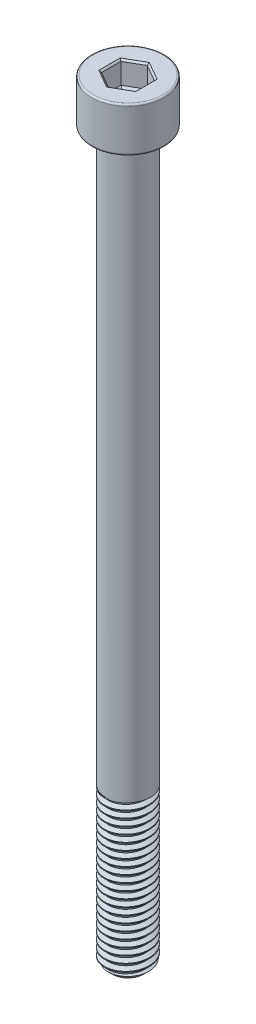
from build123d import *

# Parameters (mm, degrees)
SKETCH1_R           = 4
BOSS_EXTRUDE1_DEPTH = 28
THREAD1_PITCH       = 1.25
SKETCH2_R           = 4
BOSS_EXTRUDE2_DEPTH = 102
SKETCH5_R           = 6.5
BOSS_EXTRUDE3_DEPTH = 8
FILLET1_R           = 0.3
CUT_EXTRUDE1_DEPTH  = 4
CHAMFER1_SIZE       = 0.3
CUT_EXTRUDE2_DEPTH  = 0.4
CUT_EXTRUDE2_DRAFT  = -60


with BuildPart() as part:
    # Sketch1 → Boss-Extrude1 (new body)
    with BuildSketch(Plane(origin=(0, 0, 0), x_dir=(1, 0, 0), z_dir=(0, 1, 0))):
        with Locations(Location((0, 0, 0), (0, 0, 270))):
            Circle(SKETCH1_R)
    extrude(amount=BOSS_EXTRUDE1_DEPTH)

    # Thread1: the profile of Thread Profile1 profile screwed along a right-hand helix of 24 turns, 8 arcs to a turn; built about Z, then put on its axis
    thread1_z = Axis((0, 0, 0), (0, 0, 1))
    thread1_corners = [(4.0003, 0, -0.000173205), (4.0003, 0, 1.093923202), (3.323417656, 0, 0.703124998), (3.323417656, 0, 0.390624998)]
    with BuildLine(mode=Mode.PRIVATE) as thread1_profile:
        Line(thread1_corners[0], thread1_corners[1])
        Line(thread1_corners[1], thread1_corners[2])
        Line(thread1_corners[2], thread1_corners[3])
        Line(thread1_corners[3], thread1_corners[0])
    thread1_cap = Face(thread1_profile.wire())
    thread1_turn_angles = [0, 22.5, 45, 67.5, 90, 112.5, 135, 157.5, 180, 202.5, 225, 247.5, 270, 292.5, 315, 337.5, 360]
    thread1_turn_weights = [1, 0.9238795325112867, 1, 0.9238795325112867, 1, 0.9238795325112867, 1, 0.9238795325112867, 1, 0.9238795325112867, 1, 0.9238795325112867, 1, 0.9238795325112867, 1, 0.9238795325112867, 1]
    thread1_turn_rails = [Edge.make_bspline([Vector(p[0], p[1], 0).rotate(thread1_z, thread1_turn_angles[k]) / thread1_turn_weights[k] + Vector(0, 0, p[2] + THREAD1_PITCH * thread1_turn_angles[k] / 360) for k in range(17)], [0, 0, 0, 1, 1, 2, 2, 3, 3, 4, 4, 5, 5, 6, 6, 7, 7, 8, 8, 8], 2, thread1_turn_weights) for p in thread1_corners]
    thread1_turn_sides = [Face.make_surface_from_curves(thread1_turn_rails[p[0]], thread1_turn_rails[p[1]]) for p in [(0, 1), (1, 2), (2, 3), (3, 0)]]
    thread1 = Plane(origin=(0, 30, 0), x_dir=(-1, 0, 0), z_dir=(0, -1, 0)) * Solid(Shell([*[p.moved(Location((0, 0, THREAD1_PITCH * i))) for i in range(24) for p in thread1_turn_sides], thread1_cap, thread1_cap.rotate(thread1_z, 8640).moved(Location((0, 0, THREAD1_PITCH * 8640 / 360)))]))
    add(thread1, mode=Mode.SUBTRACT)

    # Sketch2 → Boss-Extrude2 (add)
    with BuildSketch(Plane(origin=(0, 28, 0), x_dir=(1, 0, 0), z_dir=(0, 1, 0))):
        with Locations(Location((0, 0, 0), (0, 0, 117.593571361))):
            Circle(SKETCH2_R)
    extrude(amount=BOSS_EXTRUDE2_DEPTH)

    # Sketch5 → Boss-Extrude3 (add)
    with BuildSketch(Plane(origin=(0, 130, 0), x_dir=(1, 0, 0), z_dir=(0, 1, 0))):
        with Locations(Location((0, 0, 0), (0, 0, 270))):
            Circle(SKETCH5_R)
    extrude(amount=BOSS_EXTRUDE3_DEPTH)

    # Sketch6 → Cut-Revolve1 (revolve, cut)
    with BuildSketch(Plane.XY, mode=Mode.PRIVATE) as cut_revolve1_sk:
        Polygon((4.01, 0), (4.01, 1.2), (2.81, 0), align=None)
    revolve(cut_revolve1_sk.sketch.rotate(Axis((0, 0, 0), (0, 1, 0)), 117.593571361), axis=Axis((0, 0, 0), (0, 1, 0)), mode=Mode.SUBTRACT)

    # Fillet1
    fillet1_edges = [part.edges().sort_by_distance(p)[0] for p in [
        (0, 130, -6.5),
        (0, 138, -6.5),
    ]]
    fillet(fillet1_edges, radius=FILLET1_R)

    # Sketch7 → Cut-Extrude1 (cut)
    with BuildSketch(Plane(origin=(0, 138, 0), x_dir=(1, 0, 0), z_dir=(0, 1, 0))):
        Polygon((0, 3.464101615), (-3, 1.732050808), (-3, -1.732050808), (0, -3.464101615), (3, -1.732050808), (3, 1.732050808), align=None)
    extrude(amount=-CUT_EXTRUDE1_DEPTH, mode=Mode.SUBTRACT)

    # Chamfer1
    chamfer1_edges = [part.edges().sort_by_distance(p)[0] for p in [
        (1.5, 138, -2.598076211),
        (-1.5, 138, -2.598076211),
        (-3, 138, 0),
        (-1.5, 138, 2.598076211),
        (1.5, 138, 2.598076211),
        (3, 138, 0),
    ]]
    chamfer(chamfer1_edges, length=CHAMFER1_SIZE)


with BuildPart() as cut_extrude2_tool:
    # Sketch8 → Cut-Extrude2 (with draft: the straight prism first)
    with BuildSketch(Plane(origin=(0, 134, 0), x_dir=(1, 0, 0), z_dir=(0, 1, 0))):
        Polygon((0, 3.464101615), (-3, 1.732050808), (-3, -1.732050808), (0, -3.464101615), (3, -1.732050808), (3, 1.732050808), align=None)
    extrude(amount=-CUT_EXTRUDE2_DEPTH)
    # Cut-Extrude2: the draft: its side faces are tilted about the plane it starts from
    cut_extrude2_sides = [cut_extrude2_tool.faces().sort_by_distance(p)[0] for p in [
        (-1.5, 133.8, -2.598076211),
        (-3, 133.8, 0),
        (-1.5, 133.8, 2.598076211),
        (1.5, 133.8, 2.598076211),
        (3, 133.8, 0),
        (1.5, 133.8, -2.598076211),
    ]]
    draft(cut_extrude2_sides, Plane(origin=(0, 134, 0), x_dir=(1, 0, 0), z_dir=(0, 1, 0)), CUT_EXTRUDE2_DRAFT)


with BuildPart() as part_1:
    add(part.part)

    # Cut-Extrude2: cut by cut_extrude2_tool
    add(cut_extrude2_tool.part, mode=Mode.SUBTRACT)


solid = part_1.part
